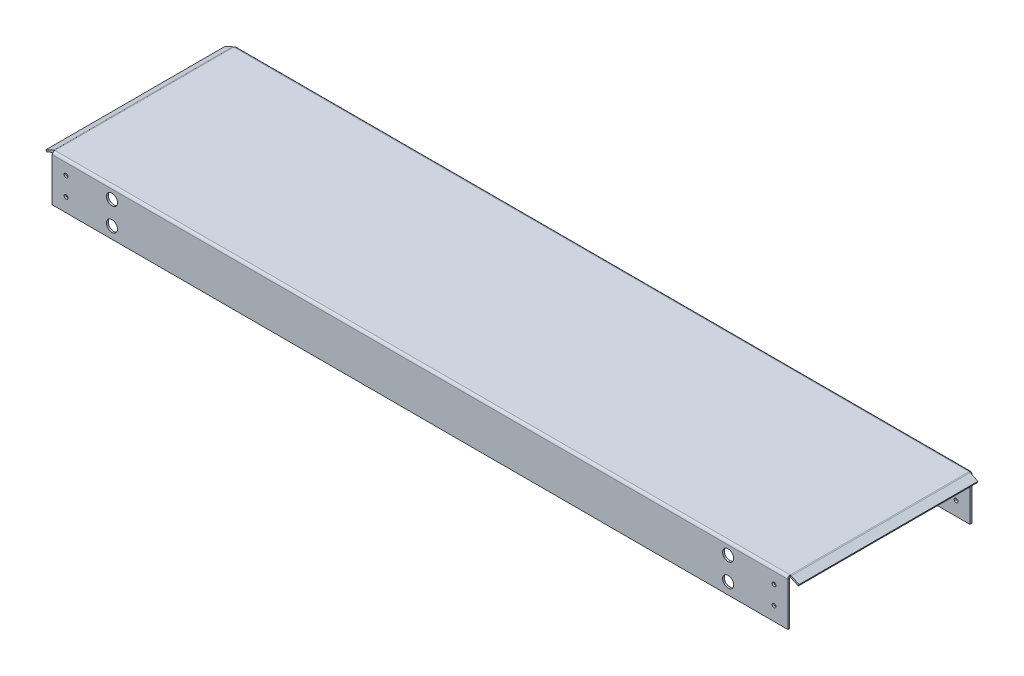
from build123d import *

# Parameters (mm, degrees)
TABAN_FLAN_1_DEPTH       = 400
M5_DI_LI_DELIK1_D        = 4.2
IZIM10_R                 = 6
KES_EKSTR_ZYON1_DEPTH    = 451
KENAR_FLAN_1_START       = -100
KENAR_FLAN_1_OUTLINE_W   = 0.163300289
KENAR_FLAN_1_OUTLINE_H   = 2.7366
KENAR_FLAN_1_DEPTH       = 2.7366
KENAR_FLAN_1_START_2     = 97.2634
KENAR_FLAN_1_2_OUTLINE_W = 0.163300289
KENAR_FLAN_1_2_OUTLINE_H = 2.7366
KENAR_FLAN_1_2_DEPTH     = 2.7366
KENAR_FLAN_1_START_3     = -97.2634
KENAR_FLAN_1_3_DEPTH     = 194.5268
KENAR_FLAN_1_4_DEPTH     = 194.5268


# Read off the part's stored shape, not the designer's step: Kenar-Flanş1
# Sheet-metal steps are written as plain solids
with BuildPart() as part:
    # Çizim1 → Taban-Flanş1 (new, symmetric)
    with BuildSketch(Plane(origin=(0, 0, 0), x_dir=(0, 0, -1), z_dir=(1, 0, 0))):
        with BuildLine():
            Line((-100, -50), (-100, -2.7366))
            ThreePointArc((-100, -2.7366), (-99.198468417, -0.801531583), (-97.2634, 0))
            Line((-97.2634, 0), (97.2634, 0))
            ThreePointArc((97.2634, 0), (99.198468417, -0.801531583), (100, -2.7366))
            Line((100, -2.7366), (100, -50))
            Line((100, -50), (98, -50))
            Line((98, -50), (98, -2.7366))
            ThreePointArc((98, -2.7366), (97.784254855, -2.215745145), (97.2634, -2))
            Line((97.2634, -2), (-97.2634, -2))
            ThreePointArc((-97.2634, -2), (-97.784254855, -2.215745145), (-98, -2.7366))
            Line((-98, -2.7366), (-98, -50))
            Line((-98, -50), (-100, -50))
        make_face()
    extrude(amount=TABAN_FLAN_1_DEPTH, both=True)

    # M5 Dişli Delik1 (through all)
    with Locations(Plane(origin=(-385, -15, 100), x_dir=(1, 0, 0), z_dir=(0, 0, 1))):
        with Locations((0, 0), (0, -20)):
            m5_di_li_delik1 = Hole(M5_DI_LI_DELIK1_D / 2)

    # Çizim10 → Kes-Ekstrüzyon1 (cut, through all)
    with BuildSketch(Plane.XY.offset(100)):
        with Locations((-335, -12.5)):
            Circle(IZIM10_R)
        with Locations((-335, -37.5)):
            Circle(IZIM10_R)
    kes_ekstr_zyon1 = extrude(amount=-KES_EKSTR_ZYON1_DEPTH, mode=Mode.SUBTRACT)

    # Aynalama1: M5 Dişli Delik1, Kes-Ekstrüzyon1 across plane
    add(m5_di_li_delik1.mirror(Plane(origin=(0, 0, 0), x_dir=(0, 0, 1), z_dir=(1, 0, 0))), mode=Mode.SUBTRACT)
    add(kes_ekstr_zyon1.mirror(Plane(origin=(0, 0, 0), x_dir=(0, 0, 1), z_dir=(1, 0, 0))), mode=Mode.SUBTRACT)

    # Kenar-Flanş1 outline → Kenar-Flanş1 (cut)
    with BuildSketch(Plane.XY.offset(KENAR_FLAN_1_START)):
        with Locations((399.918349856, -1.3683)):
            Rectangle(KENAR_FLAN_1_OUTLINE_W, KENAR_FLAN_1_OUTLINE_H)
        with Locations((-399.918349856, -1.3683)):
            Rectangle(KENAR_FLAN_1_OUTLINE_W, KENAR_FLAN_1_OUTLINE_H)
    extrude(amount=KENAR_FLAN_1_DEPTH, mode=Mode.SUBTRACT)

    # Kenar-Flan_1 2 outline → Kenar-Flan_1 2 (cut)
    with BuildSketch(Plane.XY.offset(KENAR_FLAN_1_START_2)):
        with Locations((399.918349856, -1.3683)):
            Rectangle(KENAR_FLAN_1_2_OUTLINE_W, KENAR_FLAN_1_2_OUTLINE_H)
        with Locations((-399.918349856, -1.3683)):
            Rectangle(KENAR_FLAN_1_2_OUTLINE_W, KENAR_FLAN_1_2_OUTLINE_H)
    extrude(amount=KENAR_FLAN_1_2_DEPTH, mode=Mode.SUBTRACT)

    # Kenar-Flan_1 3 outline → Kenar-Flan_1 3 (cut)
    with BuildSketch(Plane.XY.offset(KENAR_FLAN_1_START_3)):
        with BuildLine():
            Line((400, 0), (399.836699711, 0))
            ThreePointArc((399.836699711, 0), (399.918386255, -0.001219429), (400, -0.004876629))
            Line((400, -0.004876629), (400, 0))
        make_face()
        with BuildLine():
            ThreePointArc((-400, -0.004876629), (-399.918386255, -0.001219429), (-399.836699711, 0))
            Line((-399.836699711, 0), (-400, 0))
            Line((-400, 0), (-400, -0.004876629))
        make_face()
    extrude(amount=KENAR_FLAN_1_3_DEPTH, mode=Mode.SUBTRACT)

    # Kenar-Flan_1 4 outline → Kenar-Flan_1 4 (add)
    with BuildSketch(Plane.XY.offset(KENAR_FLAN_1_START_3)):
        with BuildLine():
            Line((400, -0.004876629), (400, -2))
            Line((400, -2), (399.836699711, -2))
            ThreePointArc((399.836699711, -2), (399.996129131, -2.017460361), (400.148000323, -2.069013684))
            Line((400.148000323, -2.069013684), (408.661230672, -6.038798191))
            Line((408.661230672, -6.038798191), (409.506467196, -4.226182617))
            Line((409.506467196, -4.226182617), (400.993236847, -0.25639811))
            ThreePointArc((400.993236847, -0.25639811), (400.508494673, -0.083739075), (400, -0.004876629))
        make_face()
        with BuildLine():
            Line((-399.836699711, -2), (-400, -2))
            Line((-400, -2), (-400, -0.004876629))
            ThreePointArc((-400, -0.004876629), (-400.508494673, -0.083739075), (-400.993236847, -0.25639811))
            Line((-400.993236847, -0.25639811), (-409.506467196, -4.226182617))
            Line((-409.506467196, -4.226182617), (-408.661230672, -6.038798191))
            Line((-408.661230672, -6.038798191), (-400.148000323, -2.069013684))
            ThreePointArc((-400.148000323, -2.069013684), (-399.996129131, -2.017460361), (-399.836699711, -2))
        make_face()
    extrude(amount=KENAR_FLAN_1_4_DEPTH)


solid = part.part
